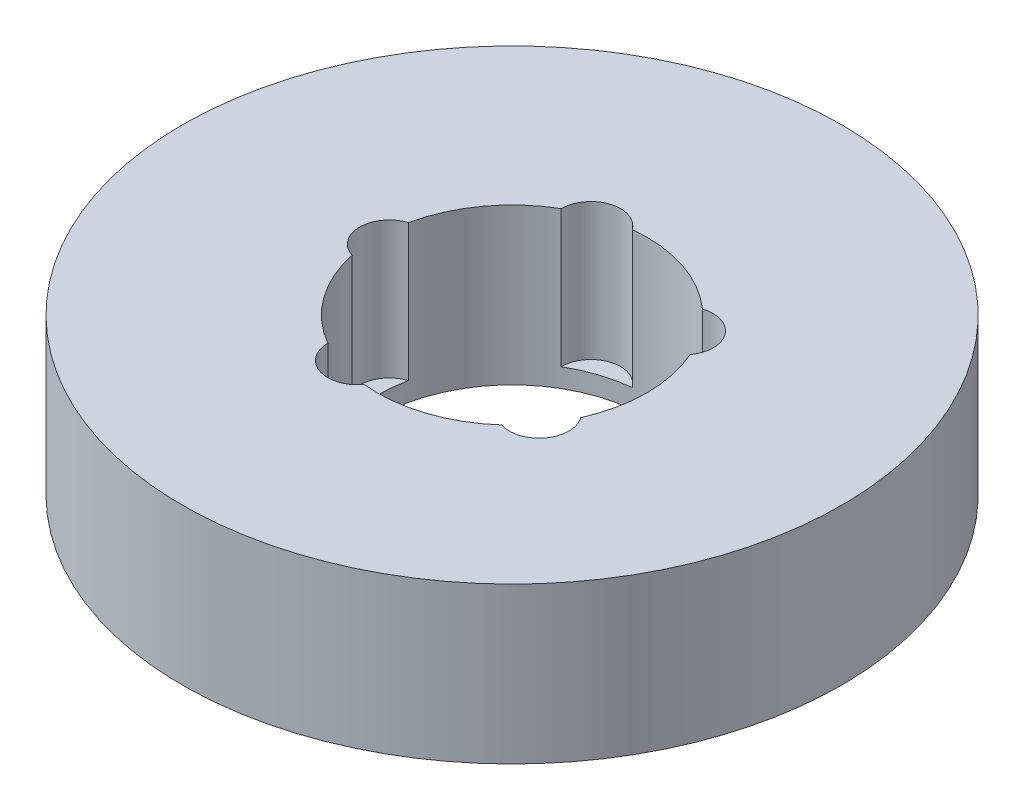
from build123d import *

# Parameters (mm, degrees)
SKETCH1_R           = 55
BOSS_EXTRUDE1_DEPTH = 26
SKETCH2_R           = 22.5
CUT_EXTRUDE1_DEPTH  = 83.012194215
SKETCH3_R           = 4.949753181
CUT_EXTRUDE2_DEPTH  = 22.835972167
CIRPATTERN1_COUNT   = 5


with BuildPart() as part:
    # Sketch1 → Boss-Extrude1 (new body)
    with BuildSketch(Plane(origin=(0, 0, 0), x_dir=(1, 0, 0), z_dir=(0, 1, 0))):
        Circle(SKETCH1_R)
    extrude(amount=BOSS_EXTRUDE1_DEPTH)

    # Sketch2 → Cut-Extrude1 (cut, through all)
    with BuildSketch(Plane(origin=(0, 0, 0), x_dir=(1, 0, 0), z_dir=(0, 1, 0))):
        Circle(SKETCH2_R)
    extrude(amount=CUT_EXTRUDE1_DEPTH, mode=Mode.SUBTRACT)

    # Sketch3 → Cut-Extrude2 (cut)
    with BuildSketch(Plane(origin=(0, 26, 0), x_dir=(1, 0, 0), z_dir=(0, 1, 0))):
        with Locations((-20.486014736, 0)):
            Circle(SKETCH3_R)
    cut_extrude2 = extrude(amount=-CUT_EXTRUDE2_DEPTH, mode=Mode.SUBTRACT)

    # CirPattern1: Cut-Extrude2 ×5 about axis
    cirpattern1_axis = Axis((0, 0, 0), (0, 1, 0))
    for i in range(1, CIRPATTERN1_COUNT):
        add(cut_extrude2.rotate(cirpattern1_axis, i * 360 / CIRPATTERN1_COUNT), mode=Mode.SUBTRACT)


solid = part.part
